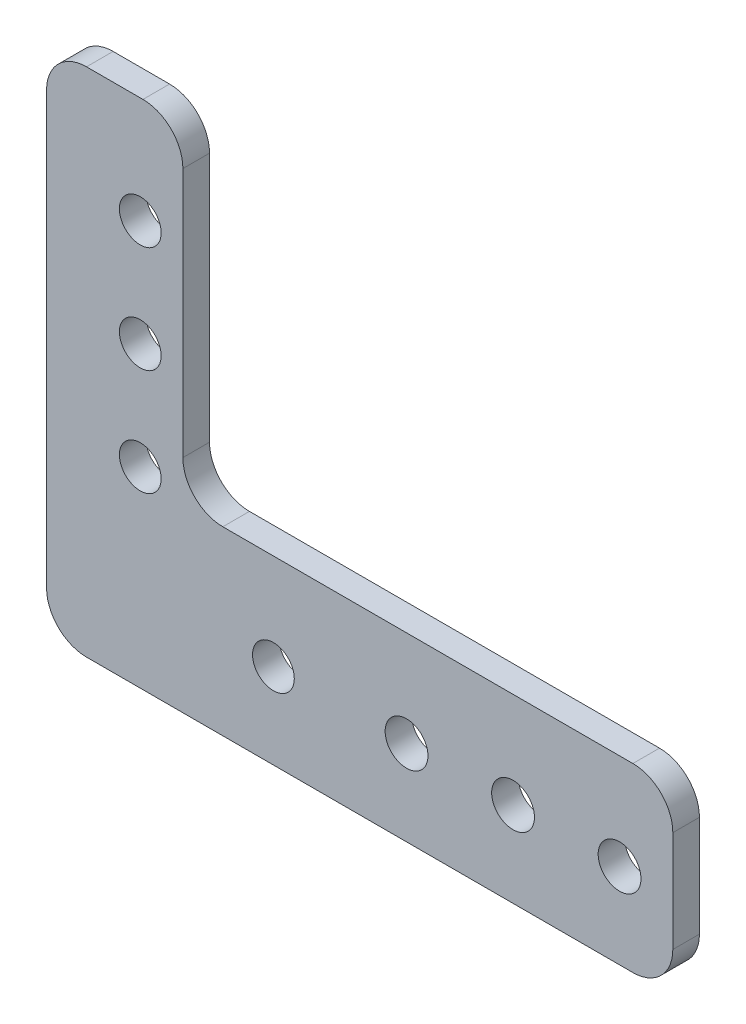
from build123d import *

# Parameters (mm, degrees)
SKETCH1_R           = 2.4892
SKETCH1_R_2         = 2.5527
BOSS_EXTRUDE1_DEPTH = 3.175
FILLET1_R           = 4.7625


with BuildPart() as part:
    # Sketch1 → Boss-Extrude1 (new body)
    with BuildSketch(Plane.XY):
        Polygon((-33.401, 31.75), (-33.401, -29.21), (41.275, -29.21), (41.275, -7.62), (-17.145, -7.62), (-17.145, 31.75), align=None)
        with Locations((-6.35, -19.05)):
            Circle(SKETCH1_R, mode=Mode.SUBTRACT)
        with Locations((-22.225, -6.35)):
            Circle(SKETCH1_R, mode=Mode.SUBTRACT)
        with Locations((9.525, -19.05)):
            Circle(SKETCH1_R_2, mode=Mode.SUBTRACT)
        with Locations((22.225, -19.05)):
            Circle(SKETCH1_R_2, mode=Mode.SUBTRACT)
        with Locations((34.925, -19.05)):
            Circle(SKETCH1_R_2, mode=Mode.SUBTRACT)
        with Locations((-22.225, 6.35)):
            Circle(SKETCH1_R, mode=Mode.SUBTRACT)
        with Locations((-22.225, 19.05)):
            Circle(SKETCH1_R, mode=Mode.SUBTRACT)
    extrude(amount=BOSS_EXTRUDE1_DEPTH)

    # Fillet1
    fillet1_edges = [part.edges().sort_by_distance(p)[0] for p in [
        (-33.401, 31.75, 1.5875),
        (-17.145, 31.75, 1.5875),
        (-17.145, -7.62, 1.5875),
        (41.275, -7.62, 1.5875),
        (41.275, -29.21, 1.5875),
        (-33.401, -29.21, 1.5875),
    ]]
    fillet(fillet1_edges, radius=FILLET1_R)


solid = part.part
